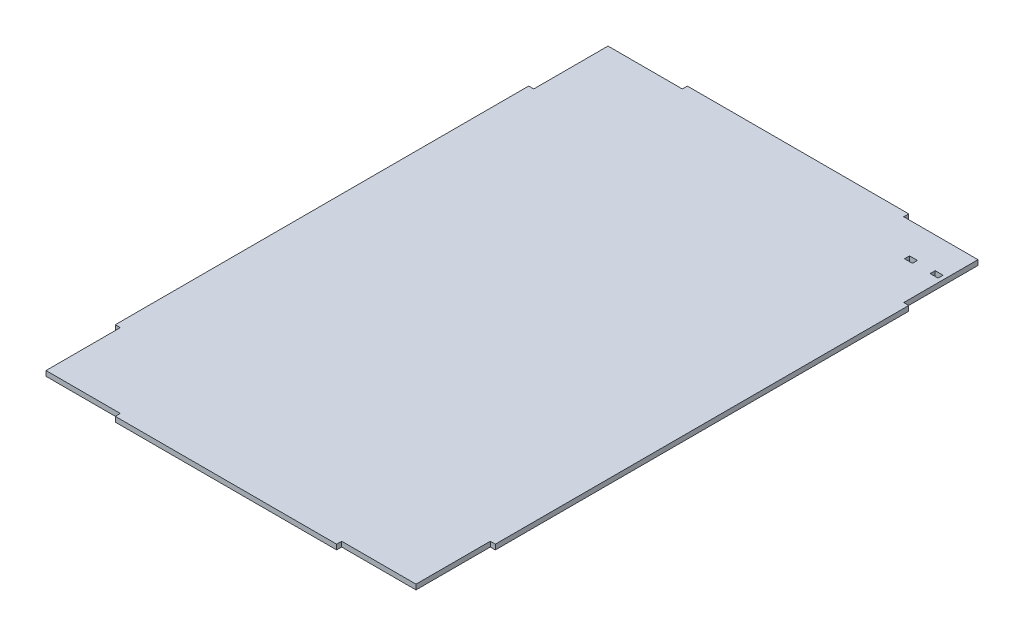
from build123d import *

# Parameters (mm, degrees)
SKETCH1_W           = 479
SKETCH1_H           = 721
BOSS_EXTRUDE1_DEPTH = 3.175
CUT_EXTRUDE1_DEPTH  = 433.851963724
SKETCH3_W           = 10
SKETCH3_H           = 6.35
CUT_EXTRUDE2_DEPTH  = 433.851963724


with BuildPart() as part:
    # Sketch1 → Boss-Extrude1 (new, symmetric)
    with BuildSketch(Plane(origin=(0, 0, 0), x_dir=(1, 0, 0), z_dir=(0, 1, 0))):
        Rectangle(SKETCH1_W, SKETCH1_H)
    extrude(amount=BOSS_EXTRUDE1_DEPTH, both=True)

    # Sketch2 → Cut-Extrude1 (cut, through all)
    with BuildSketch(Plane(origin=(0, 3.175, 0), x_dir=(1, 0, 0), z_dir=(0, 1, 0))):
        Polygon((-239.5, 360.5), (-239.5, 260.5), (-233.15, 260.5), (-233.15, 354.15), (-139.5, 354.15), (-139.5, 360.5), align=None)
        Polygon((239.5, 360.5), (139.5, 360.5), (139.5, 354.15), (233.15, 354.15), (233.15, 260.5), (239.5, 260.5), align=None)
        Polygon((239.5, -360.5), (239.5, -260.5), (233.15, -260.5), (233.15, -354.15), (139.5, -354.15), (139.5, -360.5), align=None)
        Polygon((-239.5, -360.5), (-139.5, -360.5), (-139.5, -354.15), (-233.15, -354.15), (-233.15, -260.5), (-239.5, -260.5), align=None)
    extrude(amount=-CUT_EXTRUDE1_DEPTH, mode=Mode.SUBTRACT)

    # Sketch3 → Cut-Extrude2 (cut, through all)
    with BuildSketch(Plane.XZ.offset(3.175)):
        with Locations((190.85, -311.975)):
            Rectangle(SKETCH3_W, SKETCH3_H)
        with Locations((223.15, -311.975)):
            Rectangle(SKETCH3_W, SKETCH3_H)
    extrude(amount=-CUT_EXTRUDE2_DEPTH, mode=Mode.SUBTRACT)


solid = part.part
